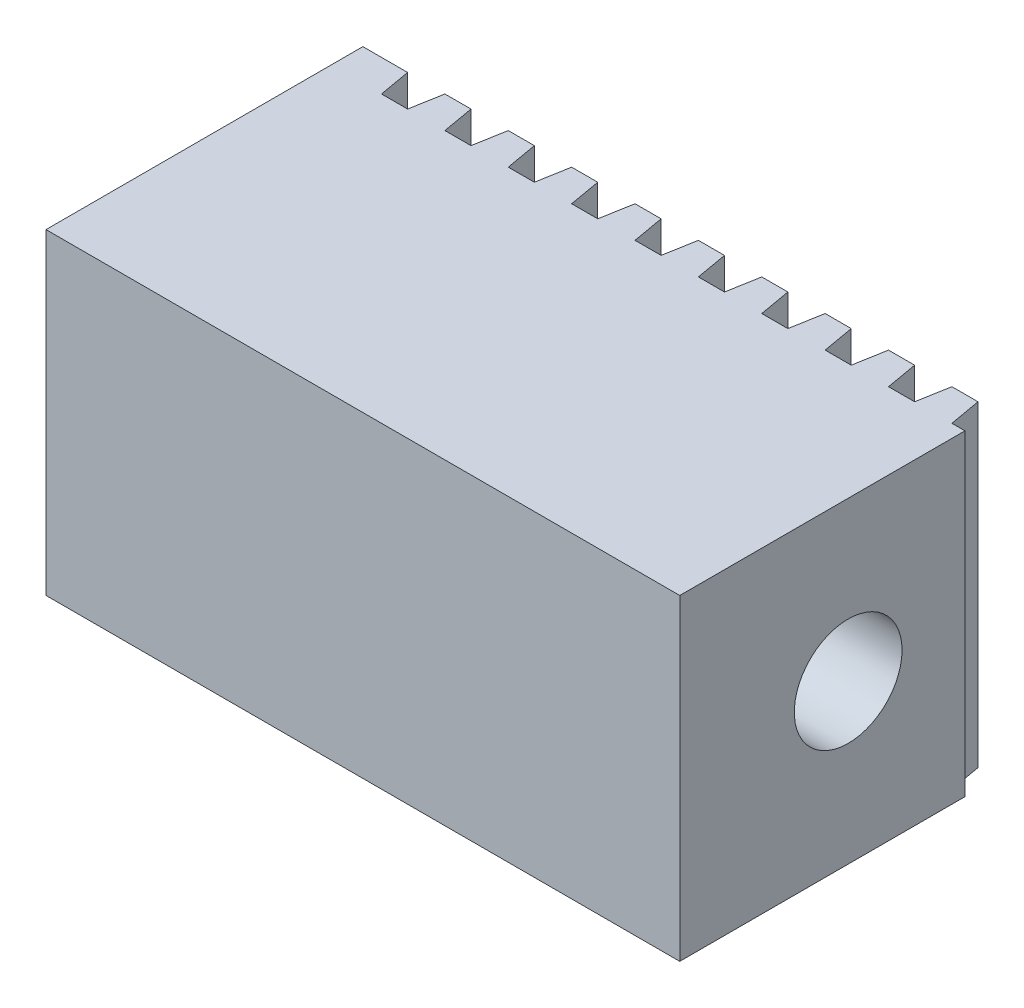
from build123d import *

# Parameters (mm, degrees)
SKETCH2_W            = 20
SKETCH2_H            = 10
BOSS_EXTRUDE1_DEPTH  = 10
CUT_EXTRUDE1_DEPTH   = 16
LPATTERN1_COUNT      = 6
LPATTERN1_PITCH      = 2
LPATTERN1_COUNT_DIR2 = 5
LPATTERN1_PITCH_DIR2 = 2
M3_CLEARANCE_HOLE1_D = 3.4


with BuildPart() as part:
    # Sketch2 → Boss-Extrude1 (new body)
    with BuildSketch(Plane(origin=(0, 0, 0), x_dir=(1, 0, 0), z_dir=(0, 1, 0))):
        Rectangle(SKETCH2_W, SKETCH2_H)
    extrude(amount=BOSS_EXTRUDE1_DEPTH)

    # Sketch3 → Cut-Extrude1 (cut, through all)
    with BuildSketch(Plane(origin=(0, 10, 0), x_dir=(1, 0, 0), z_dir=(0, 1, 0))):
        Polygon((-0.58816349, 5), (-0.41183651, 4), (0.41183651, 4), (0.58816349, 5), align=None)
    cut_extrude1 = extrude(amount=-CUT_EXTRUDE1_DEPTH, mode=Mode.SUBTRACT)

    # LPattern1: Cut-Extrude1 6 × 5
    with Locations(*[Vector(1, 0, 0) * (i * LPATTERN1_PITCH) + Vector(-1, 0, 0) * (j * LPATTERN1_PITCH_DIR2) for i in range(LPATTERN1_COUNT) for j in range(LPATTERN1_COUNT_DIR2) if (i, j) != (0, 0)]):
        add(cut_extrude1, mode=Mode.SUBTRACT)

    # M3 Clearance Hole1 (through all)
    with Locations(Plane(origin=(10, 0, 0), x_dir=(0, 0, -1), z_dir=(1, 0, 0))):
        with Locations((0.315, 4.999999998)):
            Hole(M3_CLEARANCE_HOLE1_D / 2)


solid = part.part
